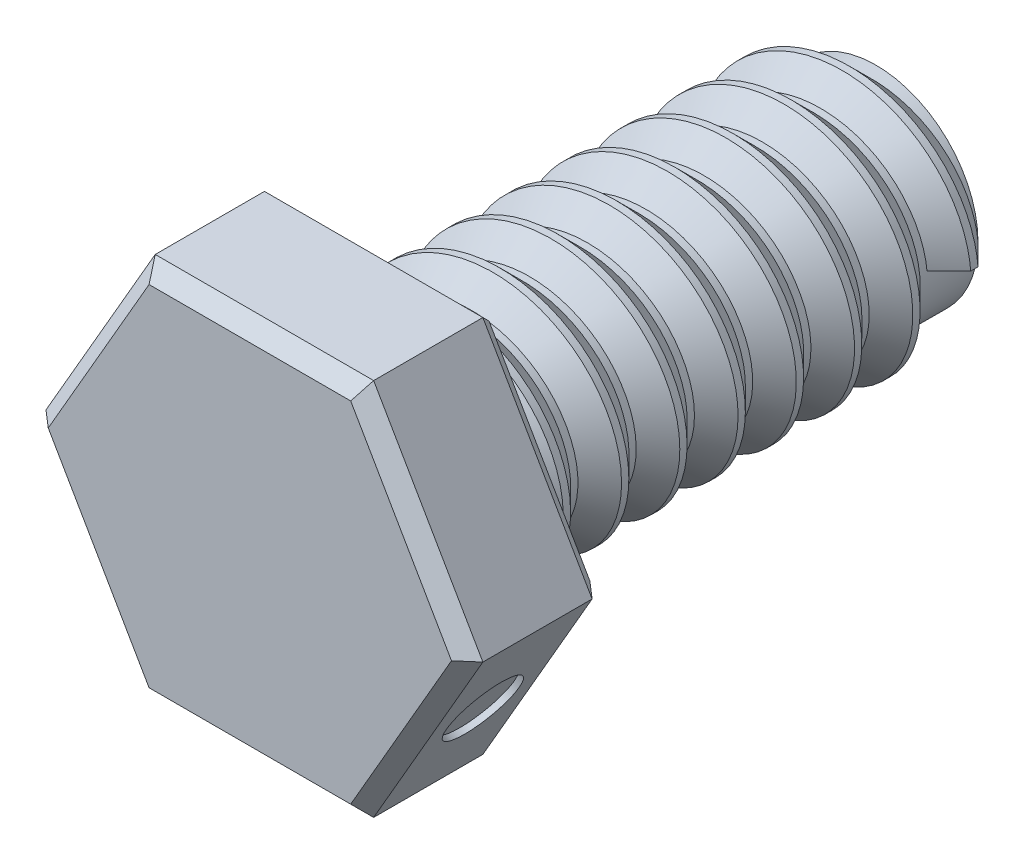
from build123d import *

# Parameters (mm, degrees)
EXTRUDE_1_DEPTH     = 9.5
SKETCH_6_R          = 7
EXTRUDE_2_DEPTH     = 33.5
SWEEP_1_PITCH       = 4
REVOLVE_2_ANGLE     = 45
CHAMFER_1_SIZE      = 1
CUT_EXTRUDE_2_DEPTH = 0.4
SKETCH_13_R         = 2.5
CUT_EXTRUDE_3_DEPTH = 0.4
CUT_EXTRUDE_4_DEPTH = 0.4
SKETCH_14_W         = 5
SKETCH_14_H         = 5
CUT_EXTRUDE_5_DEPTH = 0.4


with BuildPart() as part:
    # 草图1 → 凸台-拉伸1 (new body)
    with BuildSketch(Plane.XY):
        Polygon((15, 0), (7.5, 12.990381057), (-7.5, 12.990381057), (-15, 0), (-7.5, -12.990381057), (7.5, -12.990381057), align=None)
    extrude(amount=EXTRUDE_1_DEPTH)

    # 草图6 → 凸台-拉伸2 (add)
    with BuildSketch(Plane(origin=(0, 0, 0), x_dir=(-1, 0, 0), z_dir=(0, 0, -1))):
        Circle(SKETCH_6_R)
    extrude(amount=EXTRUDE_2_DEPTH)

    # 扫描1: the profile of 草图8 profile screwed along a right-hand helix of 7.5 turns, 12 arcs to a turn; built about Z, then put on its axis
    sweep_1_z = Axis((0, 0, 0), (0, 0, 1))
    sweep_1_corners = [(6.9997, 0, 1.7503), (6.9997, 0, -1.7503), (8.5, 0, -0.25), (8.5, 0, 0.25)]
    with BuildLine(mode=Mode.PRIVATE) as sweep_1_profile:
        Line(sweep_1_corners[0], sweep_1_corners[1])
        Line(sweep_1_corners[1], sweep_1_corners[2])
        Line(sweep_1_corners[2], sweep_1_corners[3])
        Line(sweep_1_corners[3], sweep_1_corners[0])
    sweep_1_cap = Face(sweep_1_profile.wire())
    sweep_1_turn_angles = [0, 15, 30, 45, 60, 75, 90, 105, 120, 135, 150, 165, 180, 195, 210, 225, 240, 255, 270, 285, 300, 315, 330, 345, 360]
    sweep_1_turn_weights = [1, 0.9659258262890683, 1, 0.9659258262890683, 1, 0.9659258262890683, 1, 0.9659258262890683, 1, 0.9659258262890683, 1, 0.9659258262890683, 1, 0.9659258262890683, 1, 0.9659258262890683, 1, 0.9659258262890683, 1, 0.9659258262890683, 1, 0.9659258262890683, 1, 0.9659258262890683, 1]
    sweep_1_turn_rails = [Edge.make_bspline([Vector(p[0], p[1], 0).rotate(sweep_1_z, sweep_1_turn_angles[k]) / sweep_1_turn_weights[k] + Vector(0, 0, p[2] + SWEEP_1_PITCH * sweep_1_turn_angles[k] / 360) for k in range(25)], [0, 0, 0, 1, 1, 2, 2, 3, 3, 4, 4, 5, 5, 6, 6, 7, 7, 8, 8, 9, 9, 10, 10, 11, 11, 12, 12, 12], 2, sweep_1_turn_weights) for p in sweep_1_corners]
    sweep_1_turn_sides = [Face.make_surface_from_curves(sweep_1_turn_rails[p[0]], sweep_1_turn_rails[p[1]]) for p in [(0, 1), (1, 2), (2, 3), (3, 0)]]
    sweep_1_last_angles = [2520, 2535, 2550, 2565, 2580, 2595, 2610, 2625, 2640, 2655, 2670, 2685, 2700]
    sweep_1_last_weights = [1, 0.9659258262890683, 1, 0.9659258262890683, 1, 0.9659258262890683, 1, 0.9659258262890683, 1, 0.9659258262890683, 1, 0.9659258262890755, 1]
    sweep_1_last_rails = [Edge.make_bspline([Vector(p[0], p[1], 0).rotate(sweep_1_z, sweep_1_last_angles[k]) / sweep_1_last_weights[k] + Vector(0, 0, p[2] + SWEEP_1_PITCH * sweep_1_last_angles[k] / 360) for k in range(13)], [0, 0, 0, 1, 1, 2, 2, 3, 3, 4, 4, 5, 5, 6, 6, 6], 2, sweep_1_last_weights) for p in sweep_1_corners]
    sweep_1_last_sides = [Face.make_surface_from_curves(sweep_1_last_rails[p[0]], sweep_1_last_rails[p[1]]) for p in [(0, 1), (1, 2), (2, 3), (3, 0)]]
    sweep_1 = Plane(origin=(0, 0, -1.75), x_dir=(-1, 0, 0), z_dir=(0, 0, -1)) * Solid(Shell([*[p.moved(Location((0, 0, SWEEP_1_PITCH * i))) for i in range(7) for p in sweep_1_turn_sides], *sweep_1_last_sides, sweep_1_cap, sweep_1_cap.rotate(sweep_1_z, 2700).moved(Location((0, 0, SWEEP_1_PITCH * 2700 / 360)))]))
    add(sweep_1)

    # 草图9 → 旋转2 (revolve)
    with BuildSketch(Plane(origin=(0, 0, 0), x_dir=(1, 0, 0), z_dir=(0, 1, 0))):
        Polygon((7, 3.5), (7, 0), (8.5, 1.5), (8.5, 2), align=None)
    revolve(axis=Axis((0, 0, 0), (0, 0, 1)), revolution_arc=REVOLVE_2_ANGLE)

    # 倒角1
    chamfer_1_edges = [part.edges().sort_by_distance(p)[0] for p in [
        (-11.25, 6.495190528, 9.5),
        (-11.25, -6.495190528, 9.5),
        (0, -12.990381057, 9.5),
        (11.25, -6.495190528, 9.5),
        (11.25, 6.495190528, 9.5),
        (11.25, -6.495190528, 0),
        (0, -12.990381057, 0),
        (-11.25, -6.495190528, 0),
        (-11.25, 6.495190528, 0),
        (0, 12.990381057, 0),
        (11.25, 6.495190528, 0),
        (0, 12.990381057, 9.5),
    ]]
    chamfer(chamfer_1_edges, length=CHAMFER_1_SIZE)

    # 草图11 → 切除-拉伸2 (cut)
    with BuildSketch(Plane(origin=(-11.25, -6.495190528, 0), x_dir=(0, 0, 1), z_dir=(-0.8660254037844389, -0.4999999999999995, 0))):
        Polygon((2.25, 0), (7.25, 2.886751346), (7.25, -2.886751346), align=None)
    extrude(amount=-CUT_EXTRUDE_2_DEPTH, mode=Mode.SUBTRACT)

    # 草图13 → 切除-拉伸3 (cut)
    with BuildSketch(Plane(origin=(11.25, -6.495190528, 0), x_dir=(0, 0, -1), z_dir=(0.8660254037844386, -0.5, 0))):
        with Locations(Location((-4.75, 0, 0), (0, 0, 90))):
            Circle(SKETCH_13_R)
    extrude(amount=-CUT_EXTRUDE_3_DEPTH, mode=Mode.SUBTRACT)

    # 草图12 → 切除-拉伸4 (cut)
    with BuildSketch(Plane.XZ.offset(12.990381057)):
        Polygon((-2.5, 6.825735931), (2.075735931, 2.25), (2.5, 2.674264069), (-2.075735931, 7.25), align=None)
        Polygon((2.075735931, 7.25), (-2.5, 2.674264069), (-2.075735931, 2.25), (2.5, 6.825735931), align=None)
    extrude(amount=-CUT_EXTRUDE_4_DEPTH, mode=Mode.SUBTRACT)

    # 草图14 → 切除-拉伸5 (cut)
    with BuildSketch(Plane(origin=(-11.25, 6.495190528, 0), x_dir=(0, 0, 1), z_dir=(-0.8660254037844384, 0.5000000000000006, 0))):
        with Locations((4.75, 0)):
            Rectangle(SKETCH_14_W, SKETCH_14_H)
    extrude(amount=-CUT_EXTRUDE_5_DEPTH, mode=Mode.SUBTRACT)


solid = part.part
